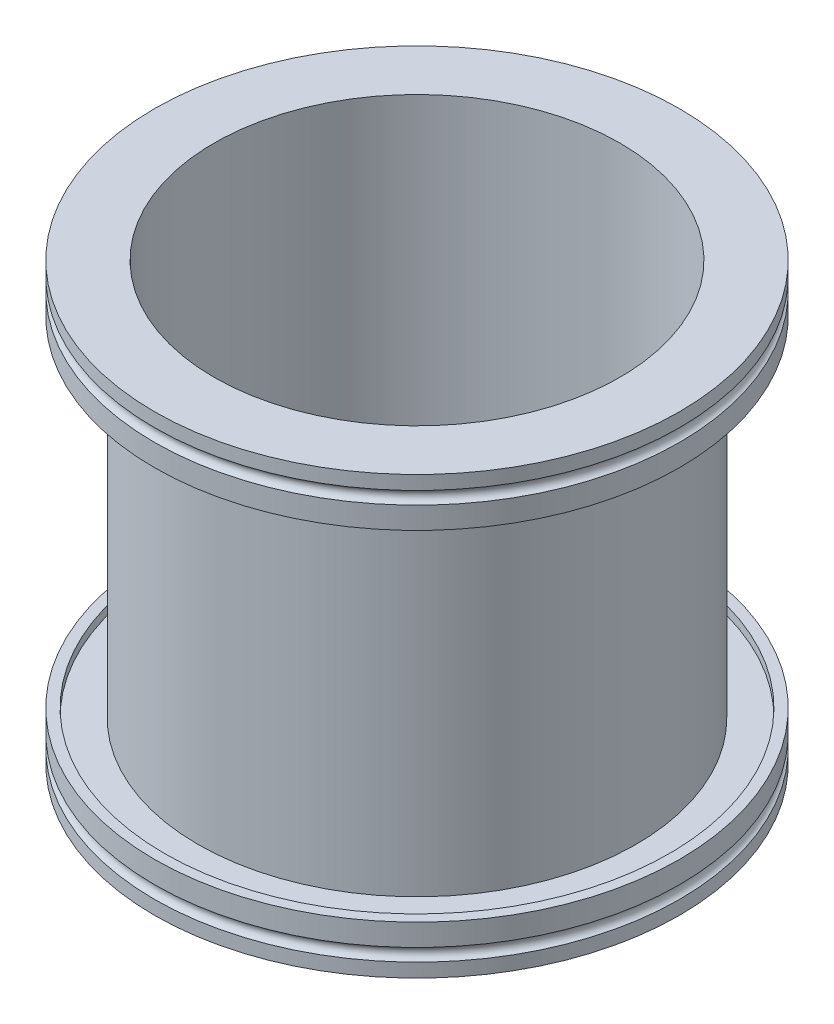
from build123d import *

# Parameters (mm, degrees)
BOSS_EXTRUDE1_START = -54
SKETCH1_R           = 65
BOSS_EXTRUDE1_DEPTH = 12
SKETCH2_R           = 54.25
CUT_EXTRUDE1_DEPTH  = 6
SKETCH3_R           = 50.25
CUT_EXTRUDE2_DEPTH  = 93.119487623
SKETCH4_R           = 62.5
CUT_EXTRUDE3_DEPTH  = 2.16
BOSS_EXTRUDE2_REACH = 139.31
SKETCH8_R           = 54.25
SKETCH8_R_2         = 50.25


# Read off the part's stored shape, not the designer's step: Cut-Revolve1
with BuildPart() as part:
    # Sketch1 → Boss-Extrude1 (new body)
    with BuildSketch(Plane(origin=(0, 0, 0), x_dir=(1, 0, 0), z_dir=(0, 1, 0)).offset(BOSS_EXTRUDE1_START)):
        with Locations(Location((0, 0, 0), (0, 0, 270))):
            Circle(SKETCH1_R)
    extrude(amount=BOSS_EXTRUDE1_DEPTH)

    # Sketch2 → Cut-Extrude1 (cut)
    with BuildSketch(Plane(origin=(0, -42, 0), x_dir=(1, 0, 0), z_dir=(0, 1, 0))):
        with Locations(Location((0, 0, 0), (0, 0, 270))):
            Circle(SKETCH2_R)
    extrude(amount=-CUT_EXTRUDE1_DEPTH, mode=Mode.SUBTRACT)

    # Sketch3 → Cut-Extrude2 (cut, through all)
    with BuildSketch(Plane(origin=(0, -48, 0), x_dir=(1, 0, 0), z_dir=(0, 1, 0))):
        with Locations(Location((0, 0, 0), (0, 0, 270))):
            Circle(SKETCH3_R)
    extrude(amount=-CUT_EXTRUDE2_DEPTH, mode=Mode.SUBTRACT)

    # Sketch4 → Cut-Extrude3 (cut)
    with BuildSketch(Plane(origin=(0, -42, 0), x_dir=(1, 0, 0), z_dir=(0, 1, 0))):
        with Locations(Location((0, 0, 0), (0, 0, 270))):
            Circle(SKETCH4_R)
    extrude(amount=-CUT_EXTRUDE3_DEPTH, mode=Mode.SUBTRACT)

    # Cut-Revolve1 outline → Cut-Revolve1 (revolve, cut)
    with BuildSketch(Plane.XY):
        with BuildLine():
            Line((65, -50.575), (65, -47.425))
            ThreePointArc((65, -47.425), (63.841807889, -49), (65, -50.575))
        make_face()
    revolve(axis=Axis((0, 0, 0), (0, 1, 0)), mode=Mode.SUBTRACT)


with BuildPart() as body_2:
    # Mirror5: mirrored copy
    add(part.part.mirror(Plane.ZX))

    # Sketch8 → Boss-Extrude2 (add, up to next)
    with BuildSketch(Plane(origin=(0, -48, 0), x_dir=(1, 0, 0), z_dir=(0, 1, 0)), mode=Mode.PRIVATE) as boss_extrude2_sk1:
        with Locations(Location((0, 0, 0), (0, 0, 270))):
            Circle(SKETCH8_R)
        with Locations(Location((0, 0, 0), (0, 0, 270))):
            Circle(SKETCH8_R_2, mode=Mode.SUBTRACT)
    boss_extrude2_tool1 = extrude(boss_extrude2_sk1.sketch, amount=BOSS_EXTRUDE2_REACH, mode=Mode.PRIVATE) - body_2.part

    add(part.part)  # Boss-Extrude2 merges part
    add(boss_extrude2_tool1.solids().sort_by_distance((0, -48, -52.715578))[0])


solid = body_2.part
